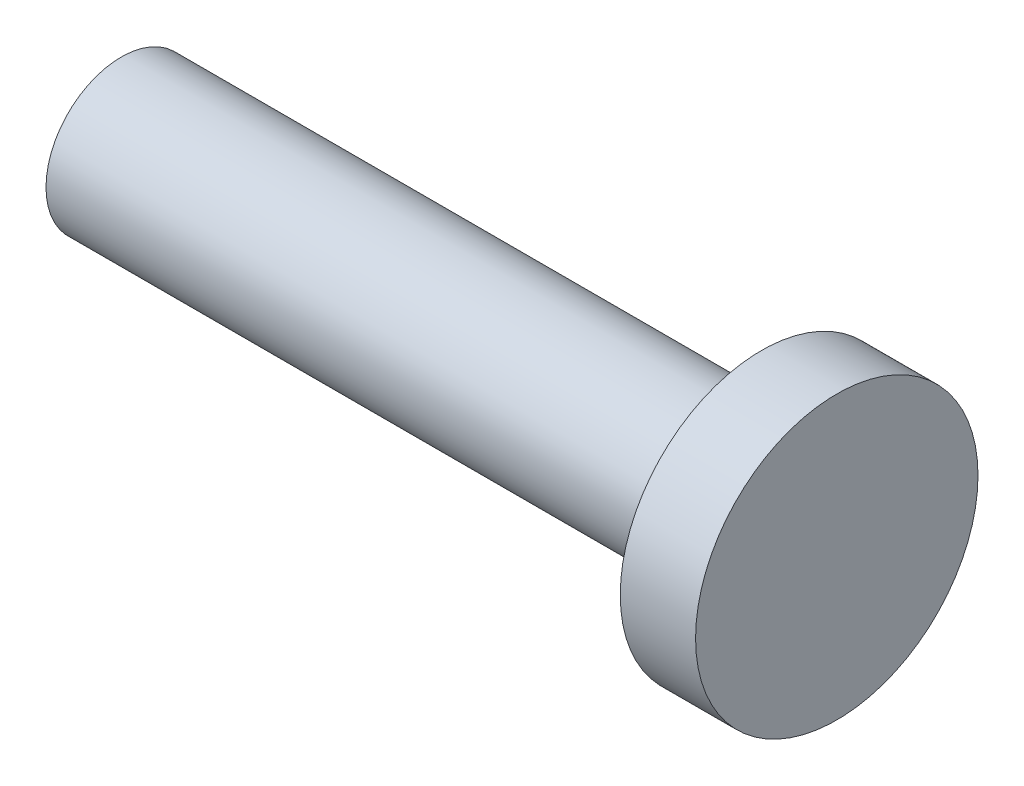
from build123d import *

# Parameters (mm, degrees)
SKETCH1_W           = 8.5
SKETCH1_H           = 1
SKETCH2_R           = 1.875
BOSS_EXTRUDE1_DEPTH = 1


with BuildPart() as part:
    # Sketch1 → Revolve1 (revolve)
    with BuildSketch(Plane.XY):
        with Locations((-145.977441652, 0.5)):
            Rectangle(SKETCH1_W, SKETCH1_H)
    revolve(axis=Axis((-150.227441652, 0, 0), (1, 0, 0)))

    # Sketch2 → Boss-Extrude1 (add)
    with BuildSketch(Plane(origin=(-141.727441652, 0, 0), x_dir=(0, 0, -1), z_dir=(1, 0, 0))):
        Circle(SKETCH2_R)
    extrude(amount=BOSS_EXTRUDE1_DEPTH)


solid = part.part
